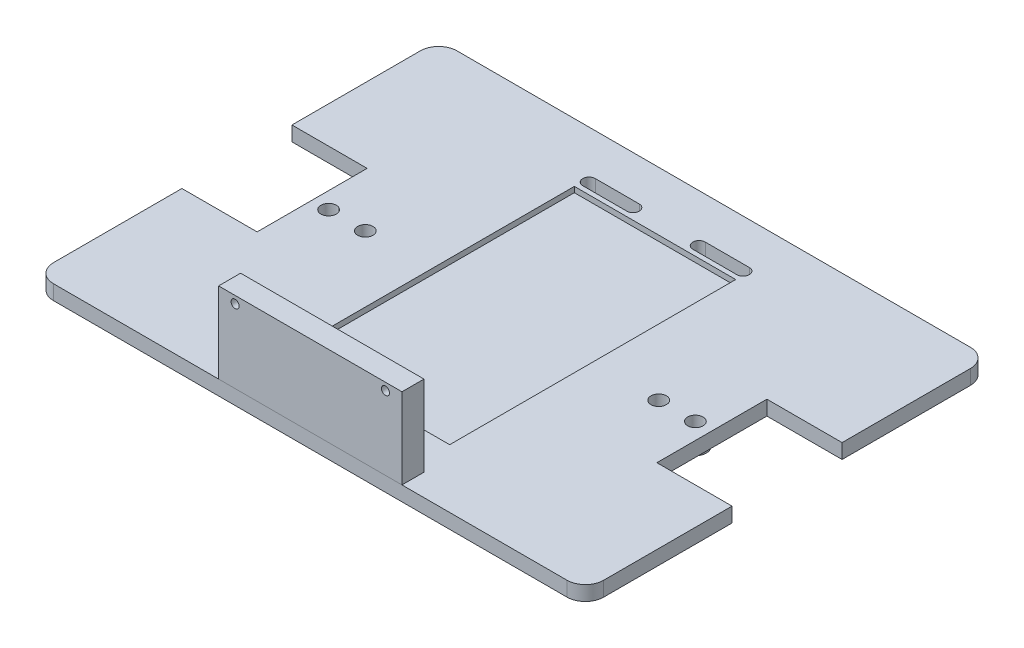
from build123d import *

# Parameters (mm, degrees)
SKETCH1_W           = 150
SKETCH1_H           = 110
BOSS_EXTRUDE1_DEPTH = 4
FILLET1_R           = 5
SKETCH2_R           = 2.1
CUT_EXTRUDE1_DEPTH  = 94.091352982
SKETCH3_R           = 3
BOSS_EXTRUDE2_DEPTH = 2
CUT_EXTRUDE2_DEPTH  = 1.5
SKETCH7_W           = 50
SKETCH7_H           = 22
BOSS_EXTRUDE4_DEPTH = 6
SKETCH8_R           = 1.1
CUT_EXTRUDE3_DEPTH  = 131.831953284
CUT_EXTRUDE4_DEPTH  = 97.571217244
SKETCH10_R          = 2.1
CUT_EXTRUDE5_DEPTH  = 96.571962416
SKETCH11_W          = 20.5
SKETCH11_H          = 30
CUT_EXTRUDE6_DEPTH  = 96.571962416


with BuildPart() as part:
    # Sketch1 → Boss-Extrude1 (new body)
    with BuildSketch(Plane(origin=(0, 0, 0), x_dir=(1, 0, 0), z_dir=(0, 1, 0))):
        Rectangle(SKETCH1_W, SKETCH1_H)
    extrude(amount=BOSS_EXTRUDE1_DEPTH)

    # Fillet1
    fillet1_edges = [part.edges().sort_by_distance(p)[0] for p in [
        (-75, 2, -55),
        (-75, 2, 55),
        (75, 2, -55),
        (75, 2, 55),
    ]]
    fillet(fillet1_edges, radius=FILLET1_R)

    # Sketch2 → Cut-Extrude1 (cut, through all)
    with BuildSketch(Plane(origin=(0, 4, 0), x_dir=(1, 0, 0), z_dir=(0, 1, 0))):
        with Locations((-50, 0)):
            Circle(SKETCH2_R)
        with Locations((-40, 0)):
            Circle(SKETCH2_R)
    cut_extrude1 = extrude(amount=-CUT_EXTRUDE1_DEPTH, mode=Mode.SUBTRACT)

    # Sketch3 → Boss-Extrude2 (add)
    with BuildSketch(Plane.XZ):
        with Locations((-50, 0)):
            Circle(SKETCH3_R)
        with Locations((-40, 0)):
            Circle(SKETCH3_R)
    boss_extrude2 = extrude(amount=BOSS_EXTRUDE2_DEPTH)

    # Mirror1: Cut-Extrude1, Boss-Extrude2 across plane
    add(cut_extrude1.mirror(Plane(origin=(0, 0, 0), x_dir=(0, 0, 1), z_dir=(1, 0, 0))), mode=Mode.SUBTRACT)
    add(boss_extrude2.mirror(Plane(origin=(0, 0, 0), x_dir=(0, 0, 1), z_dir=(1, 0, 0))))

    # Sketch4 → Cut-Extrude2 (cut)
    with BuildSketch(Plane(origin=(0, 4, 0), x_dir=(1, 0, 0), z_dir=(0, 1, 0))):
        Polygon((-22, -39), (-6, -39), (-6, -43), (6, -43), (6, -39), (22, -39), (22, 39), (-22, 39), align=None)
    extrude(amount=-CUT_EXTRUDE2_DEPTH, mode=Mode.SUBTRACT)

    # Sketch9 → Cut-Extrude4 (cut, through all)
    with BuildSketch(Plane.XZ):
        with BuildLine():
            Line((-21, -40.3), (-9, -40.3))
            ThreePointArc((-9, -40.3), (-7.3, -42), (-9, -43.7))
            Line((-9, -43.7), (-21, -43.7))
            ThreePointArc((-21, -43.7), (-22.7, -42), (-21, -40.3))
        make_face()
        with BuildLine():
            Line((21, -40.3), (9, -40.3))
            ThreePointArc((9, -40.3), (7.3, -42), (9, -43.7))
            Line((9, -43.7), (21, -43.7))
            ThreePointArc((21, -43.7), (22.7, -42), (21, -40.3))
        make_face()
    extrude(amount=-CUT_EXTRUDE4_DEPTH, mode=Mode.SUBTRACT)

    # Sketch10 → Cut-Extrude5 (cut, through all)
    with BuildSketch(Plane(origin=(0, 4, 0), x_dir=(1, 0, 0), z_dir=(0, 1, 0))):
        with Locations((-50, 0)):
            Circle(SKETCH10_R)
        with Locations((-40, 0)):
            Circle(SKETCH10_R)
        with Locations((40, 0)):
            Circle(SKETCH10_R)
        with Locations((50, 0)):
            Circle(SKETCH10_R)
    extrude(amount=-CUT_EXTRUDE5_DEPTH, mode=Mode.SUBTRACT)

    # Sketch11 → Cut-Extrude6 (cut, through all)
    with BuildSketch(Plane(origin=(0, 4, 0), x_dir=(1, 0, 0), z_dir=(0, 1, 0))):
        with Locations((64.75, 0)):
            Rectangle(SKETCH11_W, SKETCH11_H)
        with Locations((-64.75, 0)):
            Rectangle(SKETCH11_W, SKETCH11_H)
    extrude(amount=-CUT_EXTRUDE6_DEPTH, mode=Mode.SUBTRACT)


with BuildPart() as body_2:
    # Sketch7 → Boss-Extrude4 (new body)
    with BuildSketch(Plane.XY.offset(55)):
        with Locations((0, 15)):
            Rectangle(SKETCH7_W, SKETCH7_H)
    extrude(amount=-BOSS_EXTRUDE4_DEPTH)

    # Sketch8 → Cut-Extrude3 (cut, through all)
    with BuildSketch(Plane(origin=(0, 0, 49), x_dir=(-1, 0, 0), z_dir=(0, 0, -1))):
        with Locations((-20.5, 24)):
            Circle(SKETCH8_R)
        with Locations((20.5, 24)):
            Circle(SKETCH8_R)
    extrude(amount=-CUT_EXTRUDE3_DEPTH, mode=Mode.SUBTRACT)


solid = Compound([part.part, body_2.part])
